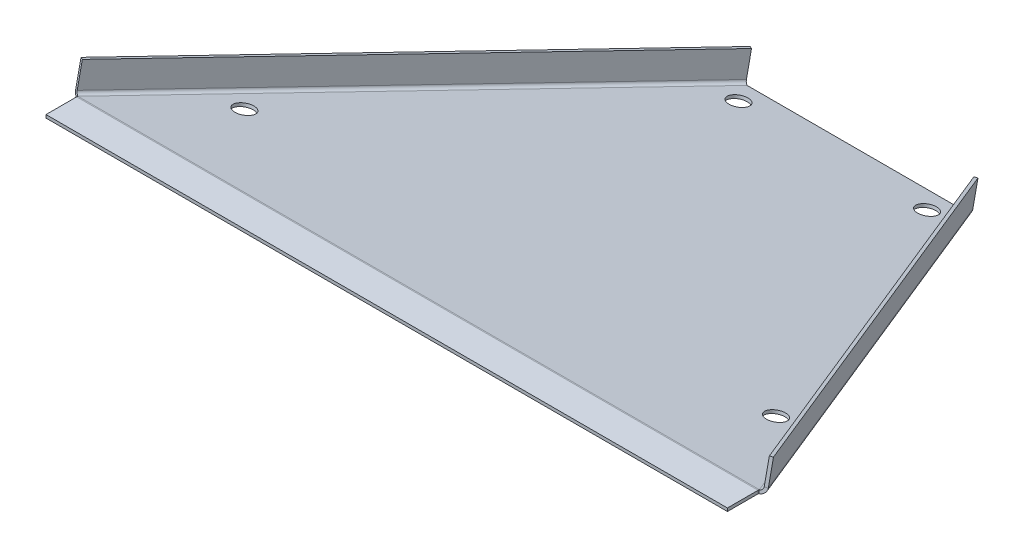
from build123d import *

# Parameters (mm, degrees)
BOSS_EXTRUDE1_DEPTH     = 279.4
CONVERT_SOLID1_START    = -279.4
CONVERT_SOLID1_DEPTH    = 558.8
CONVERT_SOLID1_2_DEPTH  = 558.8
CUT_EXTRUDE1_DEPTH      = 586.091506768
EDGE_FLANGE1_DEPTH      = 412.817360463
EDGE_FLANGE1_BEND_DEPTH = 412.817360463
SKETCH12_R              = 7.9375
CUT_EXTRUDE2_DEPTH      = 592.463463584


# Read off the part's stored shape, not the designer's step: Convert-Solid1
# Sheet-metal steps are written as plain solids
with BuildPart() as part:
    # Sketch3 → Boss-Extrude1 (new, symmetric)
    with BuildSketch(Plane(origin=(0, 0, 0), x_dir=(0, 0, -1), z_dir=(1, 0, 0))):
        Polygon((-477.990419123, 101.6), (-503.390419123, 101.6), (-503.390419123, 104.14), (-477.723454365, 104.14), (-118.969509086, 27.884494906), (-119.497604781, 25.4), align=None)
    extrude(amount=BOSS_EXTRUDE1_DEPTH, both=True)

    # Convert-Solid1 outline → Convert-Solid1 (cut)
    with BuildSketch(Plane.YZ.offset(CONVERT_SOLID1_START)):
        with BuildLine():
            Line((104.14, 477.723454365), (104.14, 478.257383881))
            ThreePointArc((104.14, 478.257383881), (104.112171228, 477.726379287), (104.028989812, 477.201192491))
            Line((104.028989812, 477.201192491), (104.14, 477.723454365))
        make_face()
    extrude(amount=CONVERT_SOLID1_DEPTH, mode=Mode.SUBTRACT)

    # Convert-Solid1 2 outline → Convert-Solid1 2 (add)
    with BuildSketch(Plane.YZ.offset(CONVERT_SOLID1_START)):
        with BuildLine():
            Line((101.6, 477.990419123), (101.6, 478.257383881))
            ThreePointArc((101.6, 478.257383881), (101.586085614, 477.991881584), (101.544494906, 477.729288186))
            Line((101.544494906, 477.729288186), (101.6, 477.990419123))
        make_face()
    extrude(amount=CONVERT_SOLID1_2_DEPTH)

    # Sketch8 → Cut-Extrude1 (cut, through all)
    with BuildSketch(Plane(origin=(0, 2.484494906, -0.528095695), x_dir=(1, 0, 0), z_dir=(0, 0.978147600733807, -0.20791169081775257))):
        Polygon((279.4, -488.402044668), (88.9, -122.167252357), (279.4, -122.167252357), align=None)
        Polygon((-88.9, -122.167252357), (-279.4, -488.402044668), (-279.4, -122.167252357), align=None)
    extrude(amount=-CUT_EXTRUDE1_DEPTH, mode=Mode.SUBTRACT)

    # Edge-Flange1 section (across the edge) → Edge-Flange1 (add)
    with BuildSketch(Plane(origin=(281.653384818, 103.785293108, 476.054689643), x_dir=(-0.8871593769725215, 0.09594358400128161, 0.4513790741037036), z_dir=(-0.46146315112880654, -0.18445080609118086, -0.8677728160541711))):
        with BuildLine():
            Line((-2.54, 2.54), (-2.54, 22.86))
            Line((-2.54, 22.86), (0, 22.86))
            Line((0, 22.86), (0, 2.54))
            ThreePointArc((0, 2.54), (0.743948776, 0.743948776), (2.54, 0))
            Line((2.54, 0), (2.54, -2.54))
            ThreePointArc((2.54, -2.54), (-1.052102448, -1.052102448), (-2.54, 2.54))
        make_face()
    extrude(amount=EDGE_FLANGE1_DEPTH)

    # Edge-Flange1 section 2 (across the edge) → Edge-Flange1 bend (add)
    with BuildSketch(Plane(origin=(-91.153384818, 27.640798203, 117.823006238), x_dir=(0.8871593769725281, 0.09594358400127896, 0.4513790741036911), z_dir=(-0.46146315112879377, 0.18445080609118228, 0.8677728160541774))):
        with BuildLine():
            Line((-2.54, 2.54), (-2.54, 22.86))
            Line((-2.54, 22.86), (0, 22.86))
            Line((0, 22.86), (0, 2.54))
            ThreePointArc((0, 2.54), (0.743948776, 0.743948776), (2.54, 0))
            Line((2.54, 0), (2.54, -2.54))
            ThreePointArc((2.54, -2.54), (-1.052102448, -1.052102448), (-2.54, 2.54))
        make_face()
    extrude(amount=EDGE_FLANGE1_BEND_DEPTH)

    # Sketch12 → Cut-Extrude2 (cut, symmetric)
    with BuildSketch(Plane(origin=(0, 2.484494906, -0.528095695), x_dir=(1, 0, 0), z_dir=(0, 0.9781476007338071, -0.2079116908177526))):
        with Locations(Location((217.989950501, -411.623430458, 0), (0, 0, 90))):
            Circle(SKETCH12_R)
        with Locations(Location((77.335982037, -141.217252357, 0), (0, 0, 90))):
            Circle(SKETCH12_R)
    cut_extrude2 = extrude(amount=CUT_EXTRUDE2_DEPTH, both=True, mode=Mode.SUBTRACT)

    # Mirror8: Cut-Extrude2 across plane
    add(cut_extrude2.mirror(Plane(origin=(0, 0, 0), x_dir=(0, 0, 1), z_dir=(1, 0, 0))), mode=Mode.SUBTRACT)


solid = part.part
